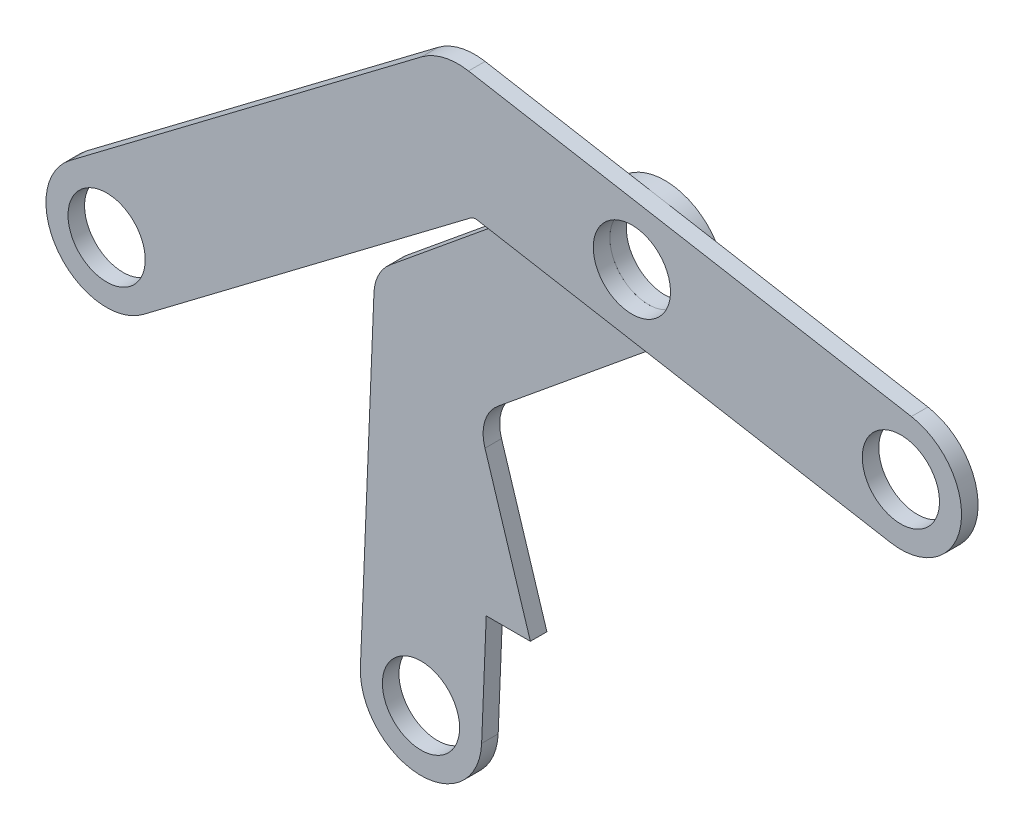
from build123d import *

# Parameters (mm, degrees)
SKETCH7_R           = 11.1125
BOSS_EXTRUDE1_DEPTH = 4.7625
SKETCH8_R           = 11.1125
BOSS_EXTRUDE2_DEPTH = 4.7625


with BuildPart() as part:
    # Sketch7 → Boss-Extrude1 (new body)
    with BuildSketch(Plane.XY):
        with BuildLine():
            Line((180.369085641, 195.182757278), (307.823869464, 172.773695291))
            ThreePointArc((307.823869464, 172.773695291), (321.998695291, 152.551130536), (301.776130536, 138.376304709))
            Line((301.776130536, 138.376304709), (182.893756024, 159.278168253))
            ThreePointArc((182.893756024, 159.278168253), (181.859072665, 159.245903347), (180.923193518, 158.803477195))
            Line((180.923193518, 158.803477195), (86.723747764, 87.664805734))
            ThreePointArc((86.723747764, 87.664805734), (62.264805734, 91.076252236), (65.676252236, 115.535194266))
            Line((65.676252236, 115.535194266), (166.821468412, 191.919256253))
            ThreePointArc((166.821468412, 191.919256253), (173.255637548, 194.960936048), (180.369085641, 195.182757278))
        make_face()
        with Locations((227.377784296, 169.187350818)):
            Circle(SKETCH7_R, mode=Mode.SUBTRACT)
        with Locations((304.8, 155.575)):
            Circle(SKETCH7_R, mode=Mode.SUBTRACT)
        with Locations((76.2, 101.6)):
            Circle(SKETCH7_R, mode=Mode.SUBTRACT)
    extrude(amount=BOSS_EXTRUDE1_DEPTH)


with BuildPart() as body_2:
    # Sketch8 → Boss-Extrude2 (new body)
    with BuildSketch(Plane.XY):
        with BuildLine():
            Line((179.372876322, 24.685494505), (180.702325656, 57.15))
            Line((180.702325656, 57.15), (193.402325656, 57.15))
            Line((193.402325656, 57.15), (180.336086908, 98.76594931))
            ThreePointArc((180.336086908, 98.76594931), (180.288058873, 105.4568549), (183.993552601, 111.028195901))
            Line((183.993552601, 111.028195901), (238.450599557, 155.684326399))
            ThreePointArc((238.450599557, 155.684326399), (240.880808715, 180.260166079), (216.304969036, 182.690375237))
            Line((216.304969036, 182.690375237), (153.019399542, 130.794637073))
            ThreePointArc((153.019399542, 130.794637073), (149.706313792, 126.640213881), (148.382991497, 121.493896037))
            Line((148.382991497, 121.493896037), (144.477123678, 26.114505495))
            ThreePointArc((144.477123678, 26.114505495), (161.210494505, 7.952123678), (179.372876322, 24.685494505))
        make_face()
        with Locations((161.925, 25.4)):
            Circle(SKETCH8_R, mode=Mode.SUBTRACT)
        with Locations((227.377784296, 169.187350818)):
            Circle(SKETCH8_R, mode=Mode.SUBTRACT)
    extrude(amount=-BOSS_EXTRUDE2_DEPTH)


solid = Compound([part.part, body_2.part])
